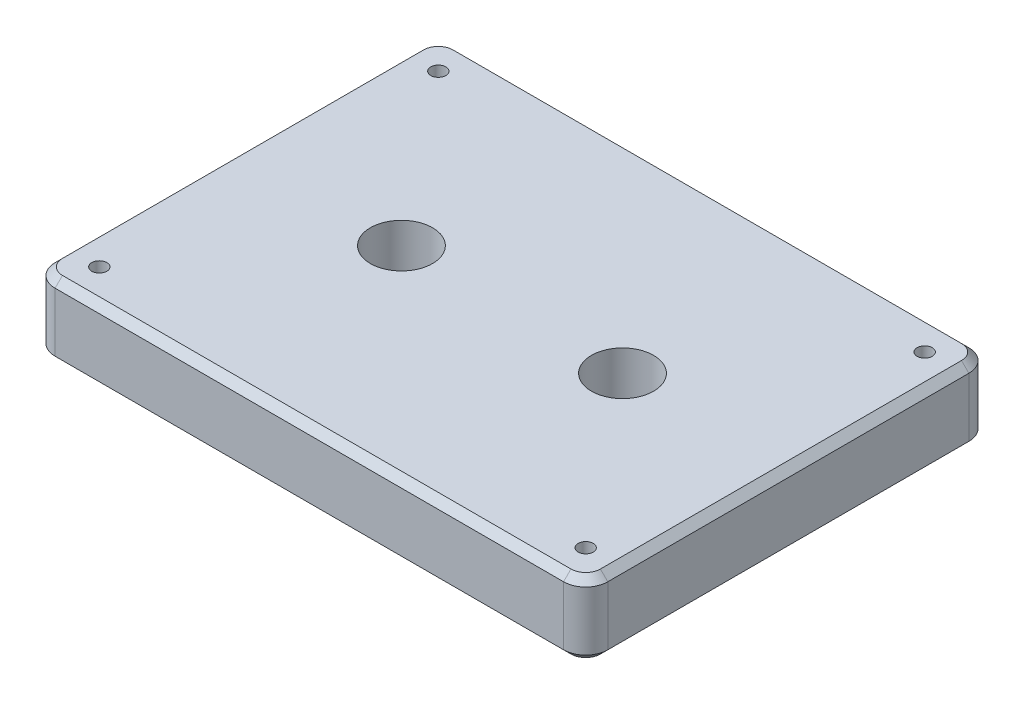
from build123d import *

# Parameters (mm, degrees)
SKETCH1_W                                 = 75
SKETCH1_H                                 = 55
BOSS_EXTRUDE1_DEPTH                       = 10
M2_5X0_45_TAPPED_HOLE1_OUTLINE_R          = 1.025
M2_5X0_45_TAPPED_HOLE1_DEPTH              = 10
CSK_FOR_8_FLAT_HEAD_MACHINE_SCREW_2_COUNT = 2
CSK_FOR_8_FLAT_HEAD_MACHINE_SCREW_2_PITCH = 30
FILLET1_R                                 = 3
CHAMFER1_SIZE                             = 1


# Read off the part's stored shape, not the designer's step: M2.5x0.45 Tapped Hole1
with BuildPart() as part:
    # Sketch1 → Boss-Extrude1 (new body)
    with BuildSketch(Plane(origin=(0, 0, 0), x_dir=(1, 0, 0), z_dir=(0, 1, 0))):
        Rectangle(SKETCH1_W, SKETCH1_H)
    extrude(amount=BOSS_EXTRUDE1_DEPTH)

    # M2.5x0.45 Tapped Hole1 outline → M2.5x0.45 Tapped Hole1 (cut)
    with BuildSketch(Plane(origin=(0, 0, 0), x_dir=(1, 0, 0), z_dir=(0, 1, 0))):
        with Locations((33, -23)):
            Circle(M2_5X0_45_TAPPED_HOLE1_OUTLINE_R)
        with Locations((-33, 23)):
            Circle(M2_5X0_45_TAPPED_HOLE1_OUTLINE_R)
        with Locations((-33, -23)):
            Circle(M2_5X0_45_TAPPED_HOLE1_OUTLINE_R)
        with Locations((33, 23)):
            Circle(M2_5X0_45_TAPPED_HOLE1_OUTLINE_R)
    extrude(amount=M2_5X0_45_TAPPED_HOLE1_DEPTH, mode=Mode.SUBTRACT)

    # Sketch6 → CSK for #8 Flat Head Machine Screw (100)1 (revolve, cut)
    with BuildSketch(Plane(origin=(15, 10, 0), x_dir=(0, 0, 1), z_dir=(1, 0, 0))):
        Polygon((0, 0), (0, 10), (2.2479, 10), (2.2479, 7.651759845), (4.216390729, 6), (4.216390729, 0), align=None)
    csk_for_8_flat_head_machine_screw_100 = revolve(axis=Axis((15, 16.35, 0), (0, -1, 0)), mode=Mode.SUBTRACT)

    # CSK for _8 Flat Head Machine Screw _ 2: CSK for #8 Flat Head Machine Screw (100)1 ×2
    with Locations(*[(-i * CSK_FOR_8_FLAT_HEAD_MACHINE_SCREW_2_PITCH, 0, 0) for i in range(1, CSK_FOR_8_FLAT_HEAD_MACHINE_SCREW_2_COUNT)]):
        add(csk_for_8_flat_head_machine_screw_100, mode=Mode.SUBTRACT)

    # Fillet1
    fillet1_edges = [part.edges().sort_by_distance(p)[0] for p in [
        (37.5, 5, 27.5),
        (-37.5, 5, 27.5),
        (-37.5, 5, -27.5),
        (37.5, 5, -27.5),
    ]]
    fillet(fillet1_edges, radius=FILLET1_R)

    # Chamfer1
    chamfer1_edges = [part.edges().sort_by_distance(p)[0] for p in [
        (37.5, 0, 0),
        (37.5, 10, 0),
        (0, 0, 27.5),
        (-37.5, 0, 0),
        (0, 0, -27.5),
        (-36.621320344, 0, 26.621320344),
        (36.621320344, 0, -26.621320344),
        (-36.621320344, 0, -26.621320344),
        (36.621320344, 0, 26.621320344),
        (0, 10, 27.5),
        (0, 10, -27.5),
        (-37.5, 10, 0),
        (-36.621320344, 10, 26.621320344),
        (36.621320344, 10, -26.621320344),
        (-36.621320344, 10, -26.621320344),
        (36.621320344, 10, 26.621320344),
    ]]
    chamfer(chamfer1_edges, length=CHAMFER1_SIZE)


solid = part.part
